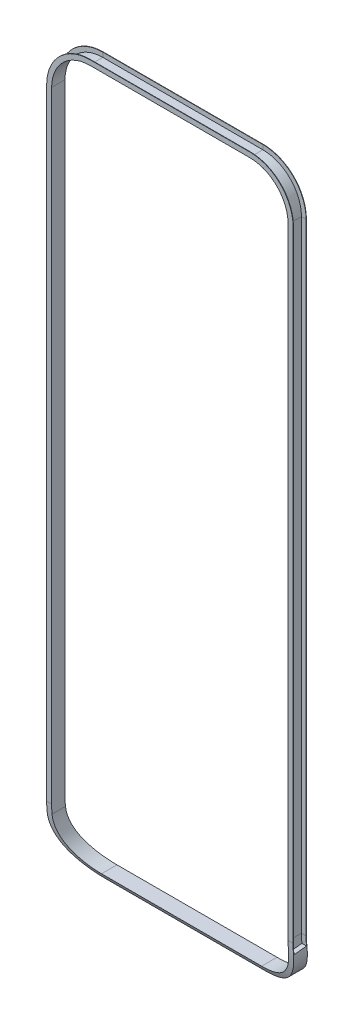
from build123d import *

# Parameters (mm, degrees)
BOSS_EXTRUDE1_DEPTH     = 100
CUT_EXTRUDE1_DEPTH      = 1968.929114577
CUT_EXTRUDE1_DEPTH_BACK = 1968.929114577
SKETCH3_W               = 33
SKETCH3_H               = 12


with BuildPart() as part:
    # Sketch1 → Boss-Extrude1 (new body)
    with BuildSketch(Plane.XY):
        with BuildLine():
            Line((-13, 100), (-13, 1748))
            ThreePointArc((-13, 1748), (20.096933726, 1827.903066274), (100, 1861))
            Line((100, 1861), (519, 1861))
            ThreePointArc((519, 1861), (598.903066274, 1827.903066274), (632, 1748))
            Line((632, 1748), (632, 100))
            ThreePointArc((632, 100), (598.903066274, 20.096933726), (519, -13))
            Line((519, -13), (100, -13))
            ThreePointArc((100, -13), (20.096933726, 20.096933726), (-13, 100))
        make_face()
        with BuildLine():
            Line((100, 0), (519, 0))
            ThreePointArc((519, 0), (589.710678119, 29.289321881), (619, 100))
            Line((619, 100), (619, 1748))
            ThreePointArc((619, 1748), (589.710678119, 1818.710678119), (519, 1848))
            Line((519, 1848), (100, 1848))
            ThreePointArc((100, 1848), (29.289321881, 1818.710678119), (0, 1748))
            Line((0, 1748), (0, 100))
            ThreePointArc((0, 100), (29.289321881, 29.289321881), (100, 0))
        make_face(mode=Mode.SUBTRACT)
    extrude(amount=-BOSS_EXTRUDE1_DEPTH)

    # Sketch2 → Cut-Extrude1 (cut, two sides: drawn at the far end of the back side and taken through both)
    with BuildSketch(Plane(origin=(0, 0, 0), x_dir=(0, 0, -1), z_dir=(1, 0, 0)).offset(-CUT_EXTRUDE1_DEPTH_BACK)):
        with BuildLine():
            Line((100, 1861), (35, 1861))
            Line((35, 1861), (35, 123.590579564))
            ThreePointArc((35, 123.590579564), (51.869398873, 37.185139921), (100, -36.53))
            Line((100, -36.53), (100, 1861))
        make_face()
        with BuildLine():
            Line((0, 123.590579564), (0, -36.53))
            Line((0, -36.53), (53.916588263, -36.53))
            ThreePointArc((53.916588263, -36.53), (13.84098777, 39.113365936), (0, 123.590579564))
        make_face()
    extrude(amount=CUT_EXTRUDE1_DEPTH + CUT_EXTRUDE1_DEPTH_BACK, mode=Mode.SUBTRACT)

    # Cut-Sweep1: sweep along a curve in space
    with BuildLine() as cut_sweep1_path:
        ThreePointArc((-13, 123.590579564, -35), (-13, 111.779668745, -35.303826234), (-13, 100, -36.214501257))
        Line((-13, 1748, -35), (-13, 123.590579564, -35))
        ThreePointArc((100, 1861, -35), (20.096933726, 1827.903066274, -35), (-13, 1748, -35))
        Line((519, 1861, -35), (100, 1861, -35))
        ThreePointArc((632, 1748, -35), (598.903066274, 1827.903066274, -35), (519, 1861, -35))
        Line((632, 1748, -35), (632, 123.590579564, -35))
        ThreePointArc((632, 123.590579564, -35), (632, 111.779668745, -35.303826234), (632, 100, -36.214501257))
    # Sketch3 → Cut-Sweep1 (sweep, cut)
    with BuildSketch(Plane(origin=(309.5, 0, 0), x_dir=(0, 0, -1), z_dir=(1, 0, 0))):
        with Locations((17.5, 1855)):
            Rectangle(SKETCH3_W, SKETCH3_H)
    sweep(path=cut_sweep1_path.line, mode=Mode.SUBTRACT)


solid = part.part
